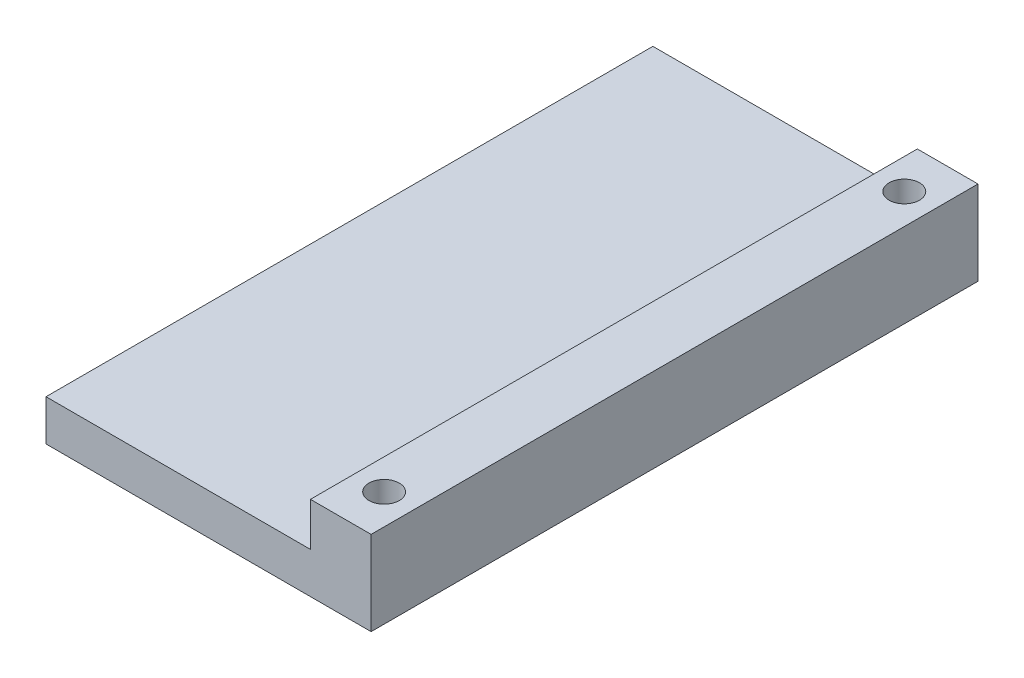
from build123d import *

# Parameters (mm, degrees)
SKETCH1_W               = 41.275
SKETCH1_H               = 88.9
BOSS_EXTRUDE1_DEPTH     = 5.9944
SKETCH1_5_W             = 8.89
SKETCH1_5_H             = 88.9
BOSS_EXTRUDE2_DEPTH     = 12.3444
CUT_EXTRUDE1_DEPTH      = 103.820821998
CUT_EXTRUDE1_DEPTH_BACK = 103.820821998
SKETCH3_R               = 2.2225
SKETCH4_R               = 3.683
CUT_EXTRUDE2_DEPTH      = 4.064
CUT_EXTRUDE3_DEPTH      = 103.274433389
CUT_EXTRUDE3_DEPTH_BACK = 103.274433389
SKETCH5_W               = 2.54
SKETCH5_H               = 88.9


with BuildPart() as part:
    # Sketch1 → Boss-Extrude1 (new body)
    with BuildSketch(Plane(origin=(0, 0, 0), x_dir=(1, 0, 0), z_dir=(0, 1, 0))):
        with Locations((20.6375, 44.45)):
            Rectangle(SKETCH1_W, SKETCH1_H)
    extrude(amount=BOSS_EXTRUDE1_DEPTH)

    # Sketch1<5> → Boss-Extrude2 (add)
    with BuildSketch(Plane(origin=(0, 0, 0), x_dir=(1, 0, 0), z_dir=(0, 1, 0))):
        with Locations((45.72, 44.45)):
            Rectangle(SKETCH1_5_W, SKETCH1_5_H)
    extrude(amount=BOSS_EXTRUDE2_DEPTH)

    # Sketch3 → Cut-Extrude1 (cut, two sides: drawn at the far end of the back side and taken through both)
    with BuildSketch(Plane(origin=(0, 12.3444, 0), x_dir=(1, 0, 0), z_dir=(0, 1, 0)).offset(-CUT_EXTRUDE1_DEPTH_BACK)):
        with Locations((45.72, 82.55)):
            Circle(SKETCH3_R)
        with Locations((45.72, 6.35)):
            Circle(SKETCH3_R)
    extrude(amount=CUT_EXTRUDE1_DEPTH + CUT_EXTRUDE1_DEPTH_BACK, mode=Mode.SUBTRACT)

    # Sketch4 → Cut-Extrude2 (cut)
    with BuildSketch(Plane.XZ):
        with Locations((45.72, -6.35)):
            Circle(SKETCH4_R)
        with Locations((45.72, -82.55)):
            Circle(SKETCH4_R)
    extrude(amount=-CUT_EXTRUDE2_DEPTH, mode=Mode.SUBTRACT)

    # Sketch5 → Cut-Extrude3 (cut, two sides: drawn at the far end of the back side and taken through both)
    with BuildSketch(Plane(origin=(0, 5.9944, 0), x_dir=(1, 0, 0), z_dir=(0, 1, 0)).offset(-CUT_EXTRUDE3_DEPTH_BACK)):
        with Locations((1.27, 44.45)):
            Rectangle(SKETCH5_W, SKETCH5_H)
    extrude(amount=CUT_EXTRUDE3_DEPTH + CUT_EXTRUDE3_DEPTH_BACK, mode=Mode.SUBTRACT)


solid = part.part
